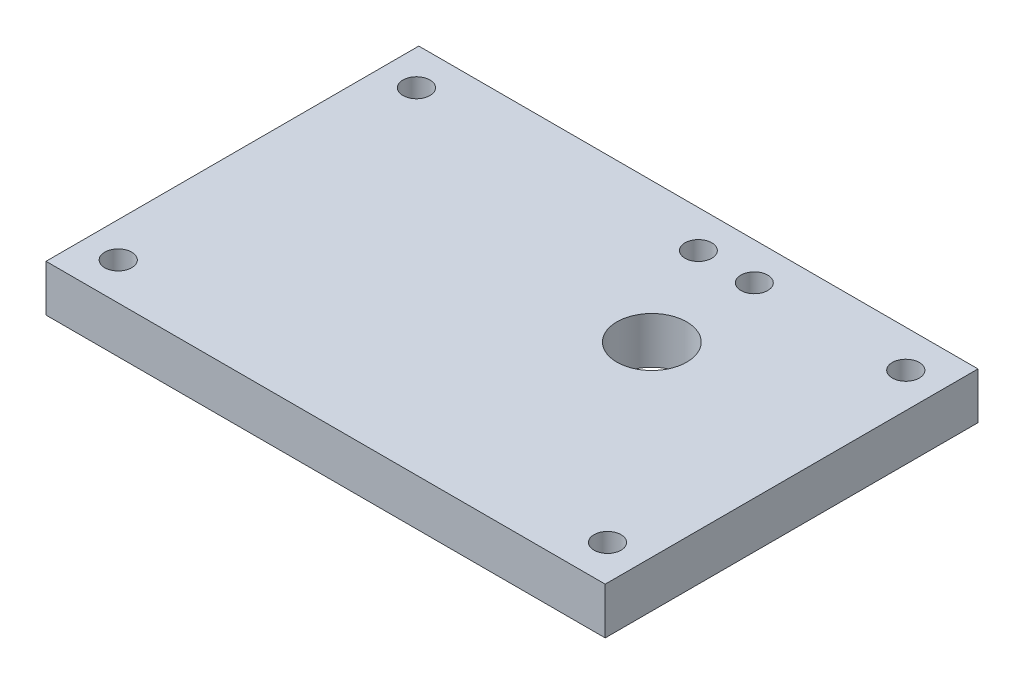
from build123d import *

# Parameters (mm, degrees)
SKETCH1_W           = 76.2
SKETCH1_H           = 50.8
BOSS_EXTRUDE1_DEPTH = 6.35
SKETCH2_R           = 1.8415
CUT_EXTRUDE1_DEPTH  = 47.228697797
SKETCH3_R           = 4.7625
SKETCH3_R_2         = 1.8288
CUT_EXTRUDE2_DEPTH  = 47.228697797


with BuildPart() as part:
    # Sketch1 → Boss-Extrude1 (new body)
    with BuildSketch(Plane(origin=(0, 0, 0), x_dir=(1, 0, 0), z_dir=(0, 1, 0))):
        Rectangle(SKETCH1_W, SKETCH1_H)
    extrude(amount=BOSS_EXTRUDE1_DEPTH)

    # Sketch2 → Cut-Extrude1 (cut, through all)
    with BuildSketch(Plane(origin=(0, 6.35, 0), x_dir=(1, 0, 0), z_dir=(0, 1, 0))):
        with Locations((-33.3375, 20.32)):
            Circle(SKETCH2_R)
        with Locations((-33.3375, -20.32)):
            Circle(SKETCH2_R)
        with Locations((33.3375, -20.32)):
            Circle(SKETCH2_R)
        with Locations((33.3375, 20.32)):
            Circle(SKETCH2_R)
    extrude(amount=-CUT_EXTRUDE1_DEPTH, mode=Mode.SUBTRACT)

    # Sketch3 → Cut-Extrude2 (cut, through all)
    with BuildSketch(Plane(origin=(0, 6.35, 0), x_dir=(1, 0, 0), z_dir=(0, 1, 0))):
        with Locations((12.7, 6.35)):
            Circle(SKETCH3_R)
        with Locations((5.08, 20.32)):
            Circle(SKETCH3_R_2)
        with Locations((12.7, 20.32)):
            Circle(SKETCH3_R_2)
    extrude(amount=-CUT_EXTRUDE2_DEPTH, mode=Mode.SUBTRACT)


solid = part.part
